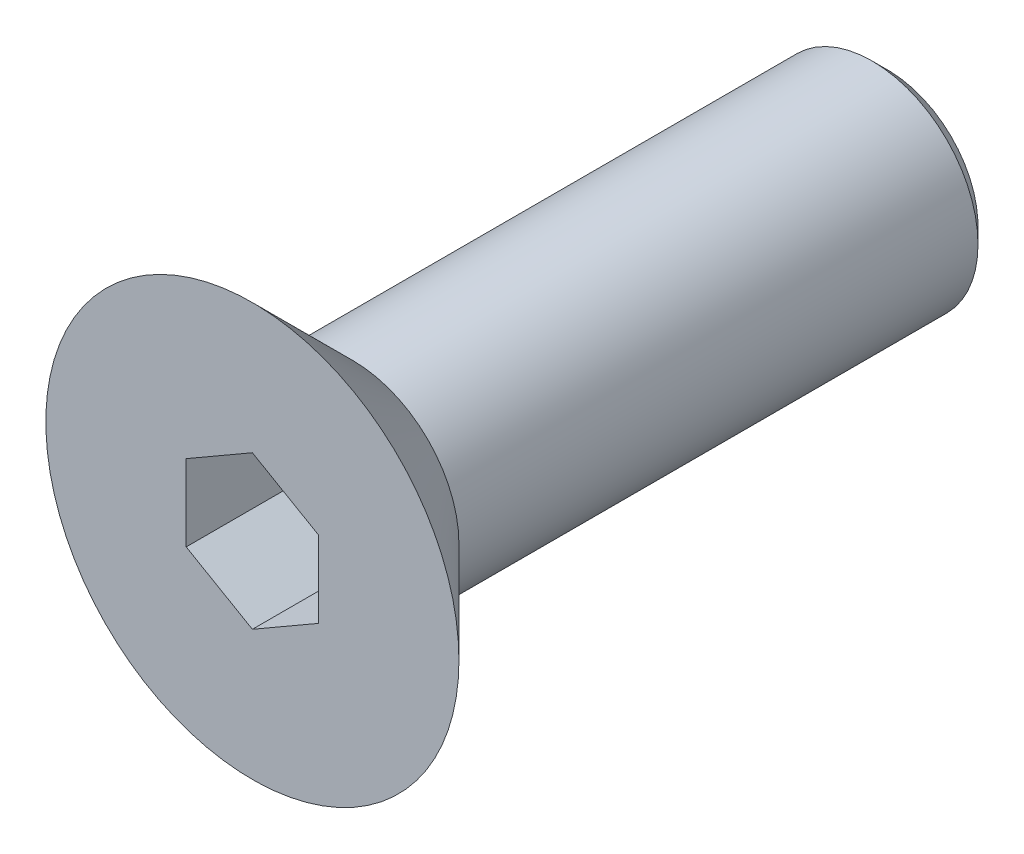
from build123d import *

# Parameters (mm, degrees)
SKETCH1_R           = 4
BOSS_EXTRUDE1_DEPTH = 2.3
SKETCH2_R           = 2
BOSS_EXTRUDE2_DEPTH = 9.7
CHAMFER1_SIZE       = 0.3
CUT_EXTRUDE1_DEPTH  = 2
CHAMFER2_SIZE       = 2.4


with BuildPart() as part:
    # Sketch1 → Boss-Extrude1 (new body)
    with BuildSketch(Plane.XY):
        Circle(SKETCH1_R)
    extrude(amount=BOSS_EXTRUDE1_DEPTH)

    # Sketch2 → Boss-Extrude2 (add)
    with BuildSketch(Plane(origin=(0, 0, 0), x_dir=(-1, 0, 0), z_dir=(0, 0, -1))):
        with Locations(Location((0, 0, 0), (0, 0, 180))):
            Circle(SKETCH2_R)
    extrude(amount=BOSS_EXTRUDE2_DEPTH)

    # Chamfer1
    chamfer1_edges = [part.edges().sort_by_distance(p)[0] for p in [
        (-2, 0, -9.7),
    ]]
    chamfer(chamfer1_edges, length=CHAMFER1_SIZE)

    # Sketch3 → Cut-Extrude1 (cut)
    with BuildSketch(Plane.XY.offset(2.3)):
        Polygon((0, 1.443375673), (-1.25, 0.721687836), (-1.25, -0.721687836), (0, -1.443375673), (1.25, -0.721687836), (1.25, 0.721687836), align=None)
    extrude(amount=-CUT_EXTRUDE1_DEPTH, mode=Mode.SUBTRACT)

    # Chamfer2
    # the kernel refuses this chamfer: 2.4 mm, written as the material it takes off along each edge
    with BuildSketch(Plane(origin=(0, 0, 0), x_dir=(1, 0, 0), z_dir=(0, -1, 0))) as chamfer2_piece_1_section:
        Polygon((4 - CHAMFER2_SIZE, 0), (4, CHAMFER2_SIZE), (4, 0), align=None)
    chamfer2_piece_1 = revolve(axis=Axis((0, 0, 0), (0, 0, 1)), mode=Mode.PRIVATE)
    chamfer2_piece_1 = chamfer2_piece_1 - Plane(origin=(0, 0, 1.405884102), x_dir=(1, 0, 0), z_dir=(0, 0, 1)) * Cylinder(2, 16, mode=Mode.PRIVATE)
    add(chamfer2_piece_1, mode=Mode.SUBTRACT)


solid = part.part
